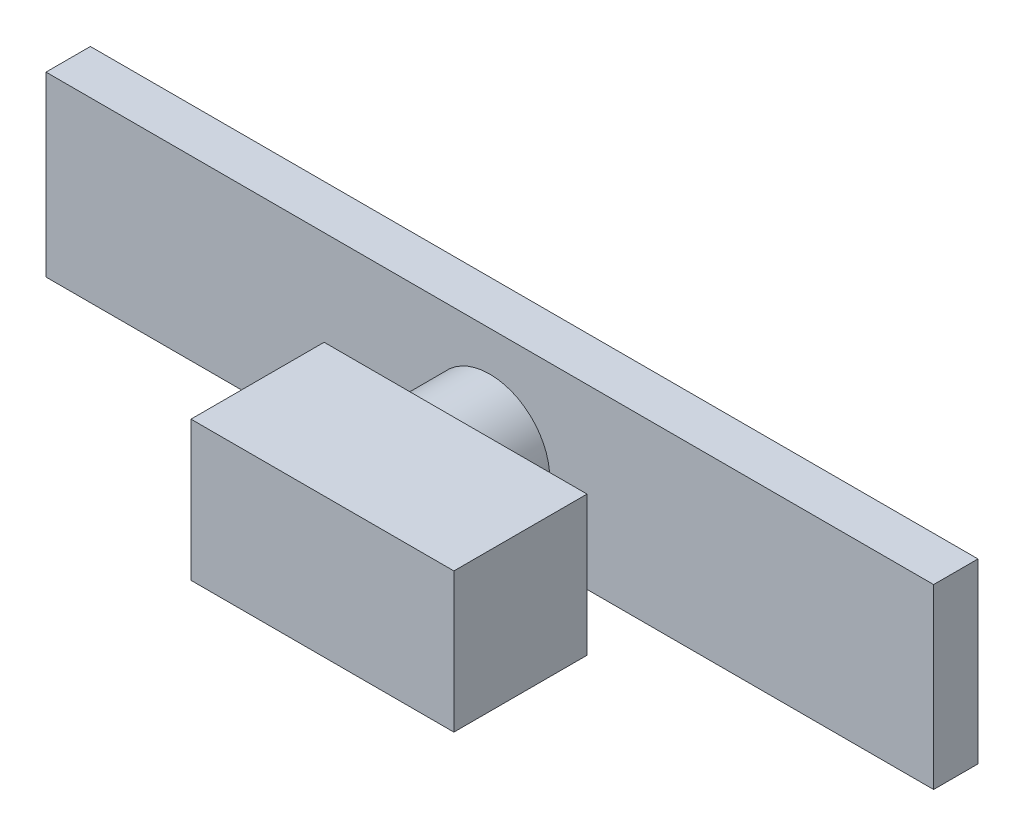
from build123d import *

# Parameters (mm, degrees)
SKETCH2_W           = 254
SKETCH2_H           = 12.7
BOSS_EXTRUDE1_DEPTH = 50.8
SKETCH3_R           = 17.140791438
BOSS_EXTRUDE2_DEPTH = 19.05
SKETCH4_W           = 75.235944222
SKETCH4_H           = 39.955088207
BOSS_EXTRUDE3_DEPTH = 38.1
SCALE2_SCALE        = 0.06
ROTATE_ANGLE        = 90
SCALE5_SCALE        = 0.25
SCALE6_SCALE        = 0.25


with BuildPart() as part:
    # Sketch2 → Boss-Extrude1 (new body)
    with BuildSketch(Plane.XY):
        with Locations((79.130769231, 14.898076923)):
            Rectangle(SKETCH2_W, SKETCH2_H)
    extrude(amount=BOSS_EXTRUDE1_DEPTH)

    # Sketch3 → Boss-Extrude2 (add)
    with BuildSketch(Plane(origin=(0, 21.248076923, 0), x_dir=(1, 0, 0), z_dir=(0, 1, 0))):
        with Locations((79.130769231, -28.483063876)):
            Circle(SKETCH3_R)
    extrude(amount=BOSS_EXTRUDE2_DEPTH)

    # Sketch4 → Boss-Extrude3 (add)
    with BuildSketch(Plane(origin=(0, 40.298076923, 0), x_dir=(1, 0, 0), z_dir=(0, 1, 0))):
        with Locations((88.38546847, -28.088530296)):
            Rectangle(SKETCH4_W, SKETCH4_H)
    extrude(amount=BOSS_EXTRUDE3_DEPTH)


with BuildPart() as part_1:
    # Scale2: scaled about (82.711857342, 33.041003565, 26.623476887)
    add(part.part.scale(SCALE2_SCALE).moved(Location((77.749145901, 31.058543351, 25.026068274))))


with BuildPart() as part_2:
    # rotate: moved
    add(part_1.part.rotate(Axis((0, 33.666927966, 26.550068274), (1, 0, 0)), ROTATE_ANGLE))


with BuildPart() as part_3:
    # Scale5: scaled about (82.711857342, 33.593519353, 25.924143873)
    add(part_2.part.scale(SCALE5_SCALE).moved(Location((62.033893007, 25.195139515, 19.443107905))))


with BuildPart() as part_4:
    # Move Body 4 x: moved
    add(part_3.part.moved(Location((-101.6, 0, 0))))


with BuildPart() as part_5:
    # Move Body 2 y: moved
    add(part_4.part.moved(Location((0, -50.8, 0))))


with BuildPart() as part_6:
    # Scale6: scaled about (-18.888142658, -17.206480647, 25.924143873)
    add(part_5.part.scale(SCALE6_SCALE).moved(Location((-14.166106993, -12.904860485, 19.443107905))))


with BuildPart() as part_7:
    # Move Body 2.1z: moved
    add(part_6.part.moved(Location((0, 0, -53.34))))


solid = part_7.part
